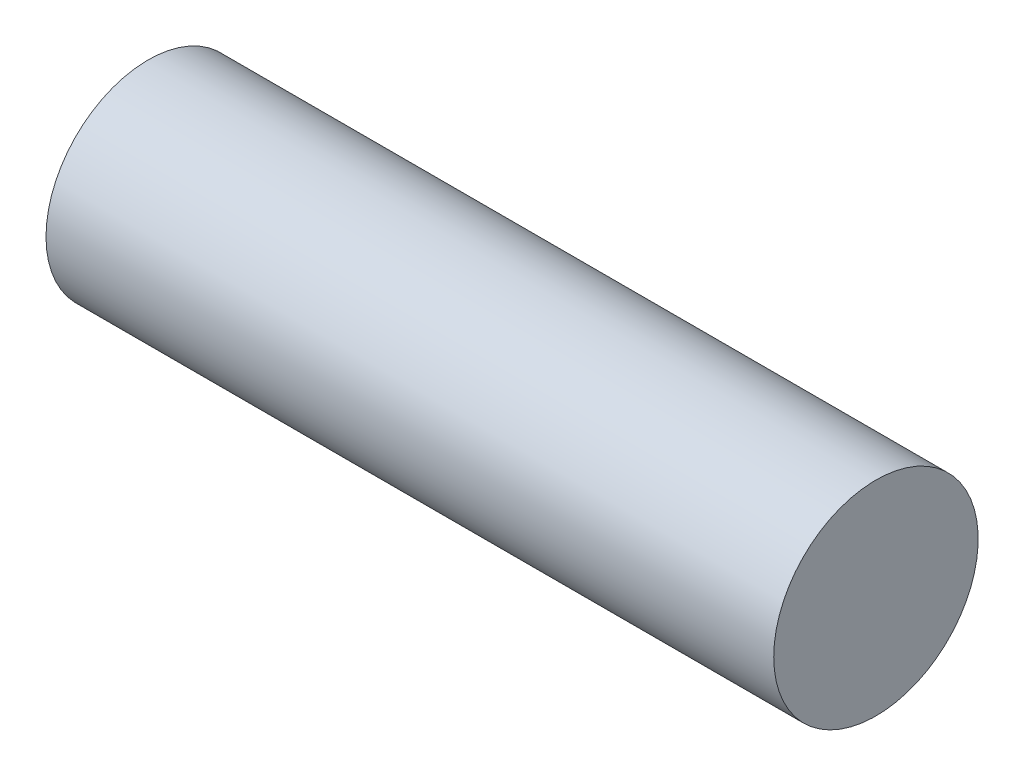
from build123d import *

# Parameters (mm, degrees)
ESQUISSE1_W = 315.189187025
ESQUISSE1_H = 44.271024873


with BuildPart() as part:
    # Esquisse1 → Révolution1 (revolve)
    with BuildSketch(Plane.XY):
        with Locations((-176.766472447, 22.135512437)):
            Rectangle(ESQUISSE1_W, ESQUISSE1_H)
    revolve(axis=Axis((-334.361065959, 0, 0), (1, 0, 0)))


solid = part.part
